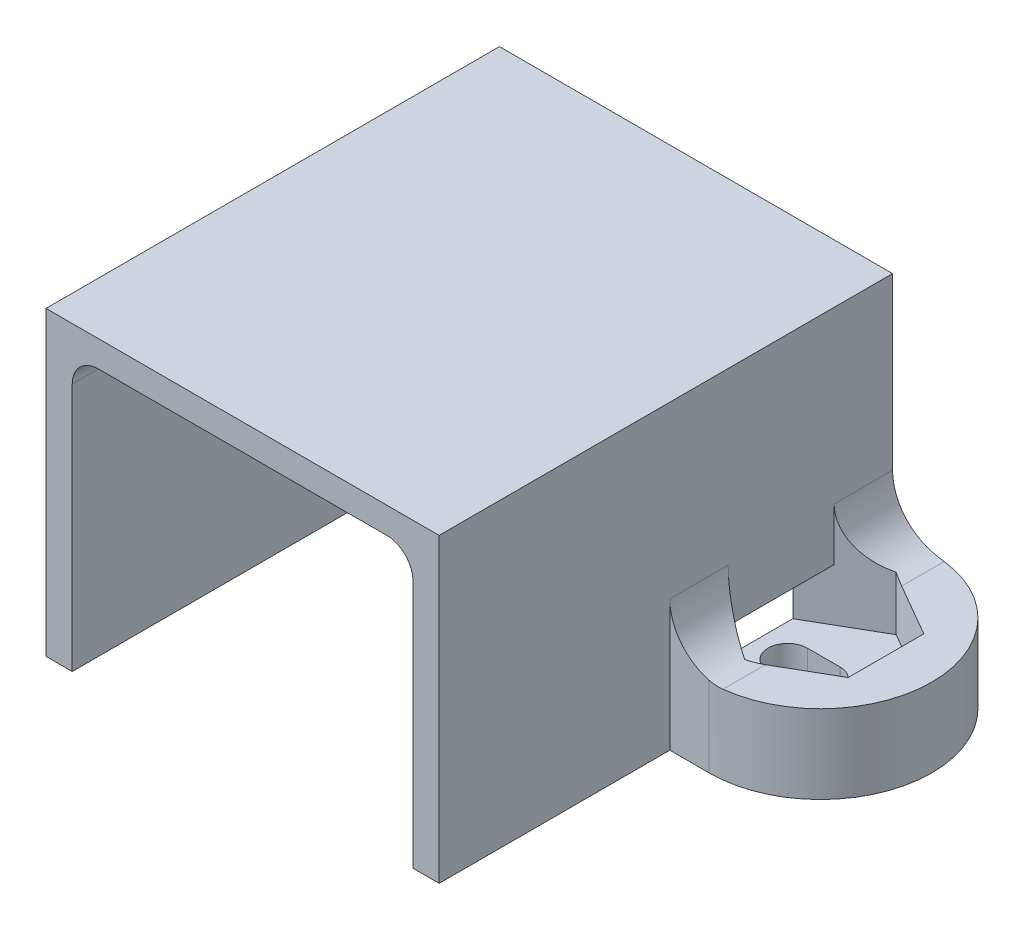
from build123d import *

# Parameters (mm, degrees)
SKETCH1_W           = 15
SKETCH1_H           = 11.5
BOSS_EXTRUDE1_DEPTH = 17.3
SKETCH2_W           = 13
SKETCH2_H           = 10.5
CUT_EXTRUDE1_DEPTH  = 26.62303651
FILLET1_R           = 1
SKETCH7_W           = 1.5
SKETCH7_H           = 8.5
BOSS_EXTRUDE4_DEPTH = 3
BOSS_EXTRUDE5_DEPTH = 3
BOSS_EXTRUDE6_DEPTH = 3
CUT_EXTRUDE4_DEPTH  = 29.32141416
CUT_EXTRUDE5_DEPTH  = 2
FILLET6_START       = -16.47329
FILLET6_DEPTH       = 0.536538654
FILLET6_START_2     = -10.163248654
FILLET6_2_DEPTH     = 0.536538654
FILLET6_START_3     = -11.029274158
FILLET6_3_DEPTH     = 2.229274158
FILLET6_START_4     = -17.3
FILLET6_4_DEPTH     = 2.229274058
FILLET6_START_5     = 3
FILLET6_5_DEPTH     = 3


with BuildPart() as part:
    # Sketch1 → Boss-Extrude1 (new body)
    with BuildSketch(Plane.XY):
        with Locations((7.5, 5.75)):
            Rectangle(SKETCH1_W, SKETCH1_H)
    extrude(amount=-BOSS_EXTRUDE1_DEPTH)

    # Sketch2 → Cut-Extrude1 (cut, through all)
    with BuildSketch(Plane.XY):
        with Locations((7.5, 5.25)):
            Rectangle(SKETCH2_W, SKETCH2_H)
    extrude(amount=-CUT_EXTRUDE1_DEPTH, mode=Mode.SUBTRACT)

    # Fillet1
    fillet1_edges = [part.edges().sort_by_distance(p)[0] for p in [
        (1, 10.5, -8.65),
        (14, 10.5, -8.65),
    ]]
    fillet(fillet1_edges, radius=FILLET1_R)

    # Sketch7 → Boss-Extrude4 (add)
    with BuildSketch(Plane.XZ):
        with Locations((-0.75, -13.05)):
            Rectangle(SKETCH7_W, SKETCH7_H)
        with Locations((15.75, -13.05)):
            Rectangle(SKETCH7_W, SKETCH7_H)
    extrude(amount=-BOSS_EXTRUDE4_DEPTH)

    # Sketch11 → Boss-Extrude5 (add)
    with BuildSketch(Plane.XZ):
        with BuildLine():
            Line((-1.5, -8.8), (-1.5, -17.3))
            ThreePointArc((-1.5, -17.3), (-5.75, -13.05), (-1.5, -8.8))
        make_face()
    extrude(amount=-BOSS_EXTRUDE5_DEPTH)

    # Sketch12 → Boss-Extrude6 (add)
    with BuildSketch(Plane.XZ):
        with BuildLine():
            Line((14, 0), (14, -17.3))
            Line((14, -17.3), (16.5, -17.3))
            ThreePointArc((16.5, -17.3), (20.75, -13.05), (16.5, -8.8))
            Line((16.5, -8.8), (15, -8.8))
            Line((15, -8.8), (15, 0))
            Line((15, 0), (14, 0))
        make_face()
    extrude(amount=-BOSS_EXTRUDE6_DEPTH)

    # Sketch13 → Cut-Extrude4 (cut, through all)
    with BuildSketch(Plane(origin=(0, 3, 0), x_dir=(1, 0, 0), z_dir=(0, 1, 0))):
        with BuildLine():
            Line((-0.25, 12.3), (-1.5, 12.3))
            ThreePointArc((-1.5, 12.3), (-2.25, 13.05), (-1.5, 13.8))
            Line((-1.5, 13.8), (-0.25, 13.8))
            ThreePointArc((-0.25, 13.8), (0.5, 13.05), (-0.25, 12.3))
        make_face()
        with BuildLine():
            Line((15.25, 13.8), (16.5, 13.8))
            ThreePointArc((16.5, 13.8), (17.25, 13.05), (16.5, 12.3))
            Line((16.5, 12.3), (15.25, 12.3))
            ThreePointArc((15.25, 12.3), (14.5, 13.05), (15.25, 13.8))
        make_face()
    extrude(amount=-CUT_EXTRUDE4_DEPTH, mode=Mode.SUBTRACT)

    # Sketch14 → Cut-Extrude5 (cut)
    with BuildSketch(Plane(origin=(0, 3, 0), x_dir=(1, 0, 0), z_dir=(0, 1, 0))):
        Polygon((-1.5, 15.936751346), (-4, 14.493375673), (-4, 11.606624327), (-1.5, 10.163248654), (1, 11.606624327), (1, 14.493375673), align=None)
        Polygon((16.5, 15.936751346), (14, 14.493375673), (14, 11.606624327), (16.5, 10.163248654), (19, 11.606624327), (19, 14.493375673), align=None)
    extrude(amount=-CUT_EXTRUDE5_DEPTH, mode=Mode.SUBTRACT)

    # Fillet6: read off the stored shape, not the designer's step
    # Fillet6 outline → Fillet6 (add)
    with BuildSketch(Plane.XY.offset(FILLET6_START)):
        with BuildLine():
            ThreePointArc((17, 3), (15.585786438, 3.585786438), (15, 5))
            Line((15, 5), (15, 3))
            Line((15, 3), (17, 3))
        make_face()
        with BuildLine():
            ThreePointArc((0, 5), (-0.585786438, 3.585786438), (-2, 3))
            Line((-2, 3), (0, 3))
            Line((0, 3), (0, 5))
        make_face()
    extrude(amount=FILLET6_DEPTH)

    # Fillet6 2 outline → Fillet6 2 (add)
    with BuildSketch(Plane.XY.offset(FILLET6_START_2)):
        with BuildLine():
            ThreePointArc((17, 3), (15.585786438, 3.585786438), (15, 5))
            Line((15, 5), (15, 3))
            Line((15, 3), (17, 3))
        make_face()
        with BuildLine():
            ThreePointArc((0, 5), (-0.585786438, 3.585786438), (-2, 3))
            Line((-2, 3), (0, 3))
            Line((0, 3), (0, 5))
        make_face()
    extrude(amount=FILLET6_2_DEPTH)

    # Fillet6 3 outline → Fillet6 3 (add)
    with BuildSketch(Plane.XY.offset(FILLET6_START_3)):
        with BuildLine():
            ThreePointArc((17, 3), (15.585786438, 3.585786438), (15, 5))
            Line((15, 5), (15, 3))
            Line((15, 3), (17, 3))
        make_face()
        with BuildLine():
            ThreePointArc((0, 5), (-0.585786438, 3.585786438), (-2, 3))
            Line((-2, 3), (0, 3))
            Line((0, 3), (0, 5))
        make_face()
    extrude(amount=FILLET6_3_DEPTH)

    # Fillet6 4 outline → Fillet6 4 (add)
    with BuildSketch(Plane.XY.offset(FILLET6_START_4)):
        with BuildLine():
            ThreePointArc((17, 3), (15.585786438, 3.585786438), (15, 5))
            Line((15, 5), (15, 3))
            Line((15, 3), (17, 3))
        make_face()
        with BuildLine():
            ThreePointArc((0, 5), (-0.585786438, 3.585786438), (-2, 3))
            Line((-2, 3), (0, 3))
            Line((0, 3), (0, 5))
        make_face()
    extrude(amount=FILLET6_4_DEPTH)

    # Fillet6 5 outline → Fillet6 5 (cut)
    with BuildSketch(Plane(origin=(0, 0, 0), x_dir=(1, 0, 0), z_dir=(0, 1, 0)).offset(FILLET6_START_5)):
        Polygon((16.5, 15.936751346), (15, 15.070725942), (17, 15.070725942), (17, 15.648076211), align=None)
        with BuildLine():
            ThreePointArc((17, 8.829514246), (16.750435167, 8.807384978), (16.5, 8.8))
            Line((16.5, 8.8), (17, 8.8))
            Line((17, 8.8), (17, 8.829514246))
        make_face()
        with BuildLine():
            Line((17, 17.3), (16.5, 17.3))
            ThreePointArc((16.5, 17.3), (16.750435167, 17.292615022), (17, 17.270485754))
            Line((17, 17.270485754), (17, 17.3))
        make_face()
        with BuildLine():
            Line((-2, 17.3), (-2, 17.270485754))
            ThreePointArc((-2, 17.270485754), (-1.750435167, 17.292615022), (-1.5, 17.3))
            Line((-1.5, 17.3), (-2, 17.3))
        make_face()
        Polygon((-1.5, 15.936751346), (-2, 15.648076211), (-2, 15.070725942), (0, 15.070725942), align=None)
        Polygon((-2, 11.029274158), (-2, 10.451923789), (-1.5, 10.163248654), (0, 11.029274058), align=None)
        with BuildLine():
            ThreePointArc((-1.5, 8.8), (-1.750435167, 8.807384978), (-2, 8.829514246))
            Line((-2, 8.829514246), (-2, 8.8))
            Line((-2, 8.8), (-1.5, 8.8))
        make_face()
        Polygon((17, 11.029274158), (15, 11.029274158), (16.5, 10.163248654), (17, 10.451923789), align=None)
    extrude(amount=FILLET6_5_DEPTH, mode=Mode.SUBTRACT)


solid = part.part
